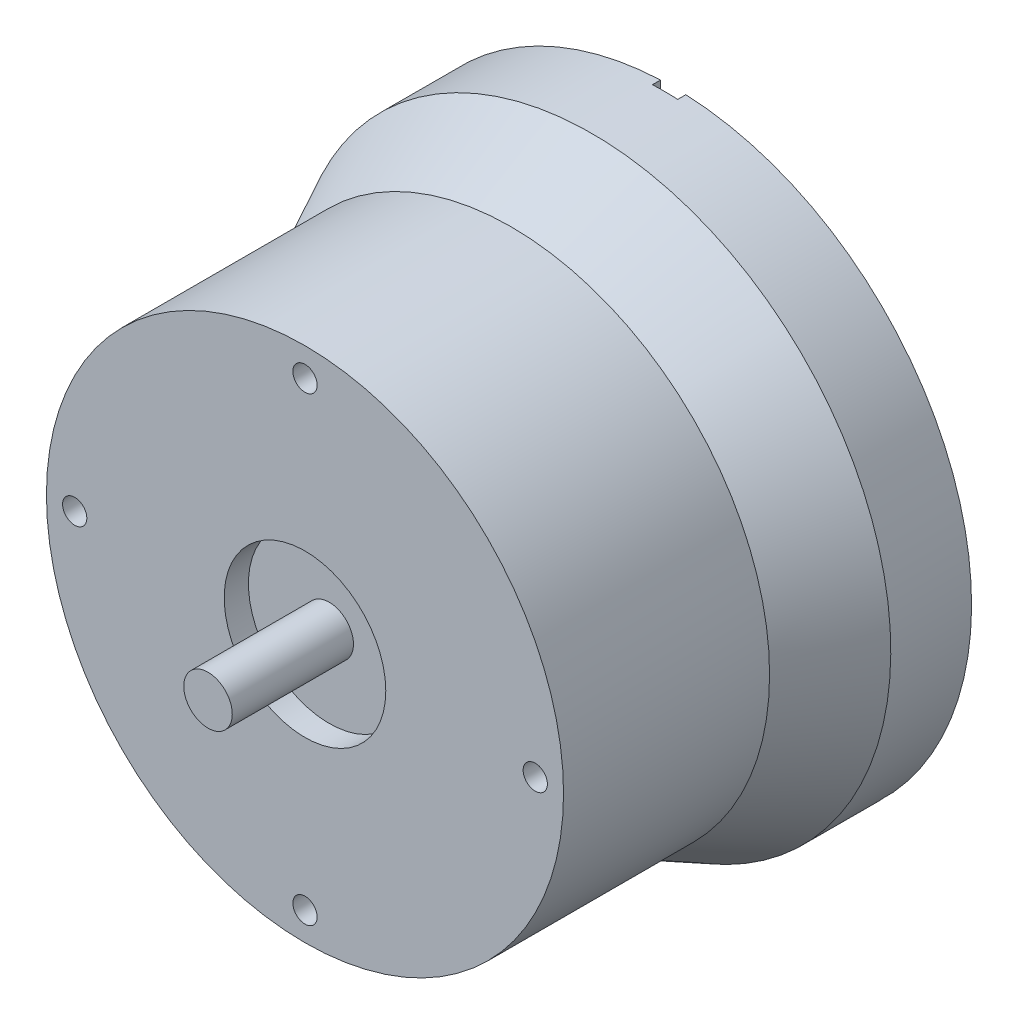
from build123d import *

# Parameters (mm, degrees)
SKETCH_1_R          = 32
EXTRUDE_1_DEPTH     = 25.5
SKETCH_3_R          = 37
EXTRUDE_3_DEPTH     = 10
SKETCH_4_R          = 1.5
CUT_EXTRUDE_1_DEPTH = 10
CUT_EXTRUDE_2_DEPTH = 5
SKETCH_7_R          = 3
EXTRUDE_4_DEPTH     = 10
CUT_EXTRUDE_START   = -1
CUT_EXTRUDE_3_DEPTH = 1
CUT_EXTRUDE_START_2 = -3
SKETCH_8_3_R        = 1.5
CUT_EXTRUDE_4_DEPTH = 3
SKETCH_9_R          = 10
SKETCH_9_R_2        = 3
CUT_EXTRUDE_5_DEPTH = 3
EXTRUDE_START       = 12
SKETCH_9_4_R        = 3
EXTRUDE_5_DEPTH     = 12


with BuildPart() as part:
    # 草图1 → 凸台-拉伸1 (new body)
    with BuildSketch(Plane.XY):
        Circle(SKETCH_1_R)
    extrude(amount=-EXTRUDE_1_DEPTH)



with BuildPart() as body_2:
    # 草图3 → 凸台-拉伸3 (new body)
    with BuildSketch(Plane(origin=(0, 0, -35.5), x_dir=(-1, 0, 0), z_dir=(0, 0, -1))):
        Circle(SKETCH_3_R)
    extrude(amount=EXTRUDE_3_DEPTH)


with BuildPart() as part_1:
    add(part.part)

    add(body_2.part)  # loft_1 joins it to this body
    # loft up to a face of the part (loft_1)
    loft([Face(Wire([part_1.edges().sort_by_distance((-21.90550739, -23.326996077, -25.5))[0]])), Face(Wire([part_1.edges().sort_by_distance((25.328242919, -26.971839215, -35.5))[0]]))])

    # 草图4 → 切除-拉伸1 (cut)
    with BuildSketch(Plane.XY):
        with Locations((28.5, 0)):
            Circle(SKETCH_4_R)
        with Locations((-28.5, 0)):
            Circle(SKETCH_4_R)
        with Locations((0, 28.5)):
            Circle(SKETCH_4_R)
        with Locations((0, -28.5)):
            Circle(SKETCH_4_R)
    extrude(amount=-CUT_EXTRUDE_1_DEPTH, mode=Mode.SUBTRACT)

    # 草图5 → 切除-拉伸2 (cut)
    with BuildSketch(Plane(origin=(0, 0, -45.5), x_dir=(-1, 0, 0), z_dir=(0, 0, -1))):
        with BuildLine():
            Line((-31.448370387, -10), (20, -10))
            Line((20, -10), (20, 10))
            Line((20, 10), (-31.448370387, 10))
            ThreePointArc((-31.448370387, 10), (-33, 0), (-31.448370387, -10))
        make_face()
    extrude(amount=-CUT_EXTRUDE_2_DEPTH, mode=Mode.SUBTRACT)

    # 草图7 → 凸台-拉伸4 (add)
    with BuildSketch(Plane(origin=(0, 0, -45.5), x_dir=(-1, 0, 0), z_dir=(0, 0, -1))):
        with Locations((28, 5)):
            Circle(SKETCH_7_R)
        with Locations((28, -5)):
            Circle(SKETCH_7_R)
    extrude(amount=EXTRUDE_4_DEPTH)

    # 草图8 → 切除-拉伸3 (cut)
    with BuildSketch(Plane(origin=(0, 0, -45.5), x_dir=(-1, 0, 0), z_dir=(0, 0, -1)).offset(CUT_EXTRUDE_START)):
        with BuildLine():
            Line((-1.632304903, 36.963976798), (-1.499003176, 33.945323885))
            ThreePointArc((-1.499003176, 33.945323885), (-0.0273426, 35.499750773), (1.5, 34))
            Line((1.5, 34), (1.5, 36.969582091))
            ThreePointArc((1.5, 36.969582091), (-0.066211794, 36.999940757), (-1.632304903, 36.963976798))
        make_face()
        with BuildLine():
            Line((-25.08100879, -27.201893281), (-22.980970389, -25.102290732))
            ThreePointArc((-22.980970389, -25.102290732), (-25.102290732, -25.102290732), (-25.102290732, -22.980970389))
            Line((-25.102290732, -22.980970389), (-27.290652839, -24.984400486))
            ThreePointArc((-27.290652839, -24.984400486), (-26.209293276, -26.1165263), (-25.08100879, -27.201893281))
        make_face()
        with BuildLine():
            Line((22.980970389, -25.102290732), (25.080782023, -27.202102366))
            ThreePointArc((25.080782023, -27.202102366), (26.162950904, -26.162950904), (27.202102366, -25.080782023))
            Line((27.202102366, -25.080782023), (25.102290732, -22.980970389))
            ThreePointArc((25.102290732, -22.980970389), (25.102290732, -25.102290732), (22.980970389, -25.102290732))
        make_face()
    extrude(amount=CUT_EXTRUDE_3_DEPTH, mode=Mode.SUBTRACT)

    # 草图8<3> → 切除-拉伸4 (cut)
    with BuildSketch(Plane(origin=(0, 0, -45.5), x_dir=(-1, 0, 0), z_dir=(0, 0, -1)).offset(CUT_EXTRUDE_START_2)):
        with Locations((0, 34)):
            Circle(SKETCH_8_3_R)
        with Locations((24.04163056, -24.04163056)):
            Circle(SKETCH_8_3_R)
        with Locations((-24.04163056, -24.04163056)):
            Circle(SKETCH_8_3_R)
    extrude(amount=CUT_EXTRUDE_4_DEPTH, mode=Mode.SUBTRACT)

    # 草图9 → 切除-拉伸5 (cut)
    with BuildSketch(Plane.XY):
        Circle(SKETCH_9_R)
        Circle(SKETCH_9_R_2, mode=Mode.SUBTRACT)
    extrude(amount=-CUT_EXTRUDE_5_DEPTH, mode=Mode.SUBTRACT)

    # 草图9<4> → 凸台-拉伸5 (add)
    with BuildSketch(Plane.XY.offset(EXTRUDE_START)):
        Circle(SKETCH_9_4_R)
    extrude(amount=-EXTRUDE_5_DEPTH)


solid = part_1.part
